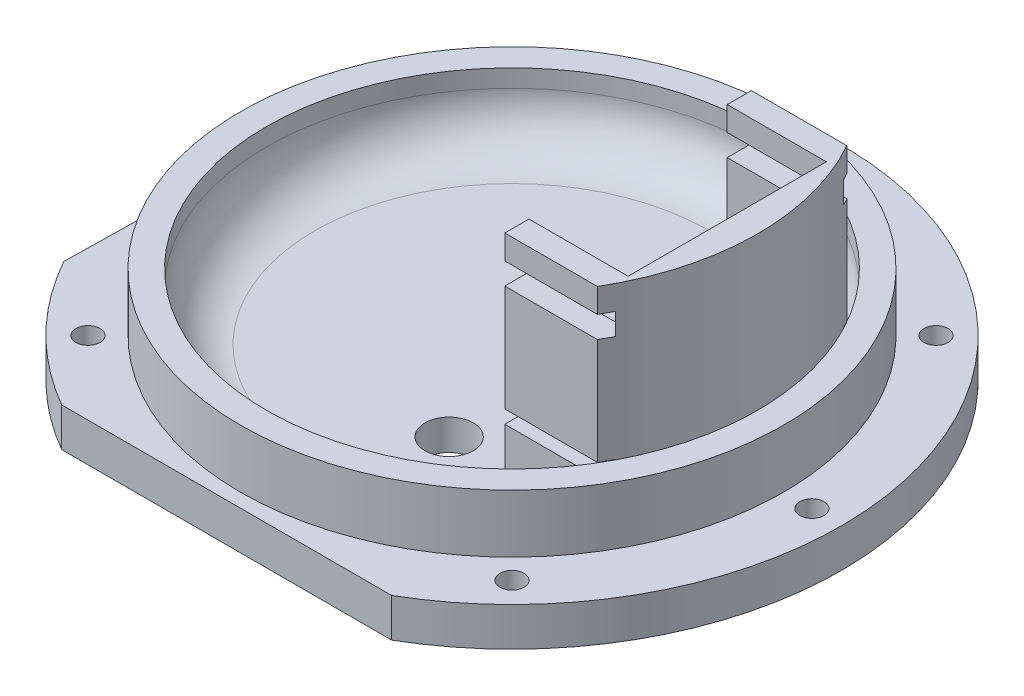
from build123d import *
from build123d.topology import SkipClean

# Parameters (mm, degrees)
SKETCH2_R            = 57.150000000000006
SKETCH2_R_2          = 50.8
BOSS_EXTRUDE1_DEPTH  = 203.2
CUT_EXTRUDE1_DEPTH   = 58.19999999999986
BOSS_EXTRUDE2_START  = -8
BOSS_EXTRUDE2_DEPTH  = 8
SKETCH5_R            = 57.15000000000001
BOSS_EXTRUDE3_DEPTH  = 6.35
FILLET1_R            = 10
FILLET3_R            = 10
BOSS_EXTRUDE4_REACH  = 173.799
BOSS_EXTRUDE5_START  = -43.000000000000014
BOSS_EXTRUDE5_DEPTH  = 43.000000000000014
SKETCH11_R           = 72.83416847853712
CUT_EXTRUDE4_DEPTH   = 150.35000000000005
CUT_EXTRUDE6_START   = -32.85
SKETCH13_R           = 69.77962088639387
SKETCH13_R_2         = 50.8
CUT_EXTRUDE6_DEPTH   = 32.85
SKETCH14_R           = 75.15
SKETCH14_R_2         = 57.15000000000001
BOSS_EXTRUDE7_DEPTH  = 8
CUT_EXTRUDE8_REACH   = 137.056
SKETCH15_W           = 5
SKETCH15_H           = 4.499999999999986
SKETCH15_H_2         = 2.75
SKETCH15_W_2         = 5.0000000000000036
CUT_EXTRUDE11_DEPTH  = 20
SKETCH17_R           = 5.000000000000003
CUT_EXTRUDE12_DEPTH  = 12
SKETCH18_R           = 0.8749999999999984
SKETCH18_R_2         = 0.8750000000042212
SKETCH18_R_3         = 0.8750000000076085
SKETCH18_R_4         = 0.8750000000088883
SKETCH18_R_5         = 0.8750000000075635
SKETCH18_R_6         = 0.8750000000041438
SKETCH18_R_7         = 0.8749999999999648
SKETCH18_R_8         = 0.8749999999966257
SKETCH18_R_9         = 0.8749999999954141
SKETCH18_R_10        = 0.8749999999968092
CUT_EXTRUDE13_DEPTH  = 32
SKETCH19_R           = 61.661434247981944
SKETCH19_R_2         = 56.650000000000006
CUT_EXTRUDE15_DEPTH  = 57
SKETCH20_R           = 62.908450380404645
SKETCH20_R_2         = 56.15000000000001
CUT_EXTRUDE18_DEPTH  = 12
SKETCH21_R           = 85.1423336954409
SKETCH21_R_2         = 68.15000000000002
CUT_EXTRUDE19_DEPTH  = 22.341781740656394
CUT_EXTRUDE20_DEPTH  = 22.341781740656394
CUT_EXTRUDE21_DEPTH  = 22.341781740656394
SKETCH24_R           = 68.15000000000002
SKETCH24_R_2         = 56.15000000000001
BOSS_EXTRUDE8_DEPTH  = 8
SKETCH25_W           = 4.834081711310596
SKETCH25_H           = 26.957976023142425
SKETCH25_W_2         = 7.090932287537861
BOSS_EXTRUDE9_DEPTH  = 8
SKETCH26_R           = 56.15000000000001
SKETCH26_R_2         = 50.8
BOSS_EXTRUDE10_DEPTH = 12
CUT_EXTRUDE22_DEPTH  = 22.341781740656394
CUT_EXTRUDE23_DEPTH  = 23.000000000000007
SKETCH29_R           = 2.5000000000000027
SKETCH29_R_2         = 2.5000000000006923
SKETCH29_R_3         = 2.500000000005469
SKETCH29_R_4         = 2.5000000000116254
SKETCH29_R_5         = 2.500000000015081
SKETCH29_R_6         = 2.500000000004599
CUT_EXTRUDE24_DEPTH  = 20.000000000000004


with BuildPart() as part:
    # Sketch2 → Boss-Extrude1 (new body)
    with BuildSketch(Plane(origin=(0, 0, 0), x_dir=(1, 0, 0), z_dir=(0, 1, 0))):
        with Locations(Location((0, 0, 0), (0, 0, 270))):
            Circle(SKETCH2_R)
        with Locations(Location((0, 0, 0), (0, 0, 270))):
            Circle(SKETCH2_R_2, mode=Mode.SUBTRACT)
    extrude(amount=BOSS_EXTRUDE1_DEPTH)

    # Sketch3 → Cut-Extrude1 (cut)
    with BuildSketch(Plane(origin=(0, 0, -57.150000000000006), x_dir=(-1, 0, 0), z_dir=(0, 0, -1))):
        Polygon((-44.999999999999986, 51.59999999999999), (45.000000000000014, 51.59999999999998), (44.999999999999986, 151.60000000000002), (-45.00000000000003, 151.60000000000002), align=None)
    extrude(amount=-CUT_EXTRUDE1_DEPTH, mode=Mode.SUBTRACT)

    # Sketch4 → Boss-Extrude2 (add)
    with SkipClean():  # the faces are left unmerged after this step: merging them gives an invalid solid
        with BuildSketch(Plane(origin=(0, 203.2, 0), x_dir=(1, 0, 0), z_dir=(0, 1, 0)).offset(BOSS_EXTRUDE2_START)):
            with BuildLine():
                Line((57.00984564090663, -4), (38.593263660903304, -4.0000000000000036))
                ThreePointArc((38.593263660903304, -4.0000000000000036), (-1.3547e-13, -38.800000000000004), (-38.59326366090334, -3.999999999999733))
                Line((-38.59326366090334, -3.999999999999733), (-57.00984564090666, -3.999999999999602))
                ThreePointArc((-57.00984564090666, -3.999999999999602), (-1.9954e-13, -57.15000000000001), (57.00984564090663, -4))
            make_face()
            with BuildLine():
                Line((57.00984564090663, 4), (38.593263660903304, 4.0000000000000036))
                ThreePointArc((38.593263660903304, 4.0000000000000036), (1.3161e-13, 38.8), (-38.59326366090328, 4.000000000000275))
                Line((-38.59326366090328, 4.000000000000275), (-57.009845640906605, 4.0000000000004))
                ThreePointArc((-57.009845640906605, 4.0000000000004), (1.9385e-13, 57.150000000000006), (57.00984564090663, 4))
            make_face()
        extrude(amount=BOSS_EXTRUDE2_DEPTH)

    # Sketch5 → Boss-Extrude3 (add)
    with BuildSketch(Plane.XZ):
        with Locations(Location((0, 0, 0), (0, 0, 90))):
            Circle(SKETCH5_R)
    extrude(amount=-BOSS_EXTRUDE3_DEPTH)

    # Fillet1
    fillet1_edges = [part.edges().sort_by_distance(p)[0] for p in [
        (3.11e-15, 6.35, -50.8),
    ]]
    fillet(fillet1_edges, radius=FILLET1_R)

    # Fillet3
    # the kernel refuses this fillet: 10 mm, written as the material it takes off along each edge
    with BuildSketch(Plane(origin=(0, 203.2, 0), x_dir=(-0.9975476052652084, 0, 0.06999125109360571), z_dir=(-0.06999125109360571, 0, -0.9975476052652084))) as fillet3_piece_1:
        with BuildLine():
            CenterArc((57.15 - FILLET3_R, -FILLET3_R), FILLET3_R, 0, 90)
            Line((57.15, -FILLET3_R), (57.15, 0))
            Line((57.15, 0), (57.15 - FILLET3_R, 0))
        make_face()
    revolve(axis=Axis((0, 203.2, 0), (0, 1, 0)), revolution_arc=85.98651528985741, mode=Mode.SUBTRACT)
    with BuildSketch(Plane(origin=(0, 203.2, 0), x_dir=(-0.9975476052652074, 0, -0.06999125109362063), z_dir=(0.06999125109362063, 0, -0.9975476052652074))) as fillet3_piece_2:
        with BuildLine():
            CenterArc((57.150000000000006 - FILLET3_R, -FILLET3_R), FILLET3_R, 0, 90)
            Line((57.150000000000006, -FILLET3_R), (57.150000000000006, 0))
            Line((57.150000000000006, 0), (57.150000000000006 - FILLET3_R, 0))
        make_face()
    revolve(axis=Axis((0, 203.2, 0), (0, 1, 0)), revolution_arc=8.026969420285985, mode=Mode.SUBTRACT)
    with BuildSketch(Plane(origin=(0, 203.2, 0), x_dir=(-1.8e-16, 0, 1), z_dir=(-1, 0, -1.8e-16))) as fillet3_piece_3:
        with BuildLine():
            CenterArc((57.150000000000006 - FILLET3_R, -FILLET3_R), FILLET3_R, 0, 90)
            Line((57.150000000000006, -FILLET3_R), (57.150000000000006, 0))
            Line((57.150000000000006, 0), (57.150000000000006 - FILLET3_R, 0))
        make_face()
    revolve(axis=Axis((0, 203.2, 0), (0, 1, 0)), revolution_arc=85.98651528985701, mode=Mode.SUBTRACT)
    with BuildSketch(Plane(origin=(0, 203.2, 0), x_dir=(0.9975476052652078, 0, 0.06999125109361341), z_dir=(-0.06999125109361341, 0, 0.9975476052652078))) as fillet3_piece_4:
        with BuildLine():
            CenterArc((57.15000000000001 - FILLET3_R, -FILLET3_R), FILLET3_R, 0, 90)
            Line((57.15000000000001, -FILLET3_R), (57.15000000000001, 0))
            Line((57.15000000000001, 0), (57.15000000000001 - FILLET3_R, 0))
        make_face()
    revolve(axis=Axis((0, 203.2, 0), (0, 1, 0)), revolution_arc=8.026969420286012, mode=Mode.SUBTRACT)
    with BuildSketch(Plane(origin=(0, 203.2, -3.55e-15), x_dir=(-0.9975476052652074, 0, -0.06999125109362023), z_dir=(-0.06999125109362023, 0, 0.9975476052652074))) as fillet3_piece_5:
        with BuildLine():
            CenterArc((57.15000000000001 - FILLET3_R, FILLET3_R), FILLET3_R, 270, 90)
            Line((57.15000000000001, FILLET3_R), (57.15000000000001, 0))
            Line((57.15000000000001, 0), (57.15000000000001 - FILLET3_R, 0))
        make_face()
    revolve(axis=Axis((0, 203.2, -3.55e-15), (0, -1, 0)), revolution_arc=171.9730305797136, mode=Mode.SUBTRACT)

    # Boss-Extrude4: up to this face of the body (flat: up to its plane)
    boss_extrude4_end = Plane(part.part.faces().sort_by_distance((0, 6.35, 0))[0])
    # Sketch8 → Boss-Extrude4 (add, up to the picked face)
    with BuildSketch(Plane(origin=(-3.98e-15, 51.59999999999999, 0), x_dir=(1, 8e-17, 0), z_dir=(-8e-17, 1, 0)), mode=Mode.PRIVATE) as boss_extrude4_sk1:
        Polygon((44.999999999999986, -21), (44.99999999999999, 20), (24.49999999999999, 19.999999999999996), (24.49999999999999, 24.999999999999996), (49.999999999999986, 25), (49.999999999999986, -26.000000000000004), (24.499999999999982, -25.999999999999996), (24.499999999999982, -20.99999999999999), align=None)
    boss_extrude4_tool1 = split(extrude(boss_extrude4_sk1.sketch, amount=-BOSS_EXTRUDE4_REACH, mode=Mode.PRIVATE), bisect_by=boss_extrude4_end, keep=Keep.BOTH, mode=Mode.PRIVATE)
    add(boss_extrude4_tool1.solids().sort_by(Axis((45.570197, 51.6, 0.5), (8e-17, -1, 0)))[0])

    # Sketch9 → Boss-Extrude5 (add)
    with SkipClean():  # the faces are left unmerged after this step: merging them gives an invalid solid
        with BuildSketch(Plane(origin=(-3.98e-15, 51.59999999999999, 0), x_dir=(1, 8e-17, 0), z_dir=(-8e-17, 1, 0)).offset(BOSS_EXTRUDE5_START)):
            with BuildLine():
                Line((49.999999999999986, -8.97997772825755), (49.999999999999964, 8.979977728257717))
                ThreePointArc((49.999999999999964, 8.979977728257717), (50.800000000000004, 8.319e-14), (49.999999999999986, -8.97997772825755))
            make_face()
        extrude(amount=BOSS_EXTRUDE5_DEPTH)

    # Sketch11 → Cut-Extrude4 (cut)
    with BuildSketch(Plane(origin=(0, 203.2, 0), x_dir=(1, 0, 0), z_dir=(0, 1, 0))):
        Circle(SKETCH11_R)
    extrude(amount=-CUT_EXTRUDE4_DEPTH, mode=Mode.SUBTRACT)

    # Sketch13 → Cut-Extrude6 (cut)
    with BuildSketch(Plane(origin=(0, 52.84999999999995, 0), x_dir=(1, 0, 0), z_dir=(0, 1, 0)).offset(CUT_EXTRUDE6_START)):
        Circle(SKETCH13_R)
        Circle(SKETCH13_R_2, mode=Mode.SUBTRACT)
    extrude(amount=CUT_EXTRUDE6_DEPTH, mode=Mode.SUBTRACT)

    # Sketch14 → Boss-Extrude7 (add)
    with BuildSketch(Plane.XZ):
        with Locations(Location((0, 0, 0), (0, 0, 270))):
            Circle(SKETCH14_R)
        with Locations(Location((0, 0, 0), (0, 0, 270))):
            Circle(SKETCH14_R_2, mode=Mode.SUBTRACT)
    extrude(amount=-BOSS_EXTRUDE7_DEPTH)

    # Cut-Extrude8: up to this face of the body (flat: up to its plane)
    cut_extrude8_end = Plane(part.part.faces().sort_by_distance((45, 29.950685238, 0.465203094))[0])
    # Sketch15 → Cut-Extrude8 (cut, up to the picked face)
    with BuildSketch(Plane.ZY.offset(-24.49999999999999), mode=Mode.PRIVATE) as cut_extrude8_sk1:
        with Locations((-22.499999999999996, 44.34999999999999)):
            Rectangle(SKETCH15_W, SKETCH15_H)
    cut_extrude8_tool1 = split(extrude(cut_extrude8_sk1.sketch, amount=-CUT_EXTRUDE8_REACH, mode=Mode.PRIVATE), bisect_by=cut_extrude8_end, keep=Keep.BOTH, mode=Mode.PRIVATE)
    # Sketch15 → Cut-Extrude8 (cut, up to the picked face)
    with BuildSketch(Plane.ZY.offset(-24.49999999999999), mode=Mode.PRIVATE) as cut_extrude8_sk2:
        with Locations((-22.499999999999996, 18.724999999999994)):
            Rectangle(SKETCH15_W, SKETCH15_H_2)
    cut_extrude8_tool2 = split(extrude(cut_extrude8_sk2.sketch, amount=-CUT_EXTRUDE8_REACH, mode=Mode.PRIVATE), bisect_by=cut_extrude8_end, keep=Keep.BOTH, mode=Mode.PRIVATE)
    # Sketch15 → Cut-Extrude8 (cut, up to the picked face)
    with BuildSketch(Plane.ZY.offset(-24.49999999999999), mode=Mode.PRIVATE) as cut_extrude8_sk3:
        with Locations((23.499999999999993, 18.724999999999994)):
            Rectangle(SKETCH15_W_2, SKETCH15_H_2)
    cut_extrude8_tool3 = split(extrude(cut_extrude8_sk3.sketch, amount=-CUT_EXTRUDE8_REACH, mode=Mode.PRIVATE), bisect_by=cut_extrude8_end, keep=Keep.BOTH, mode=Mode.PRIVATE)
    # Sketch15 → Cut-Extrude8 (cut, up to the picked face)
    with BuildSketch(Plane.ZY.offset(-24.49999999999999), mode=Mode.PRIVATE) as cut_extrude8_sk4:
        with Locations((23.499999999999993, 44.34999999999999)):
            Rectangle(SKETCH15_W_2, SKETCH15_H)
    cut_extrude8_tool4 = split(extrude(cut_extrude8_sk4.sketch, amount=-CUT_EXTRUDE8_REACH, mode=Mode.PRIVATE), bisect_by=cut_extrude8_end, keep=Keep.BOTH, mode=Mode.PRIVATE)
    add(cut_extrude8_tool1.solids().sort_by(Axis((24.5, 44.35, -22.5), (1, 8e-17, 0)))[0], mode=Mode.SUBTRACT)
    add(cut_extrude8_tool2.solids().sort_by(Axis((24.5, 18.725, -22.5), (1, 8e-17, 0)))[0], mode=Mode.SUBTRACT)
    add(cut_extrude8_tool3.solids().sort_by(Axis((24.5, 18.725, 23.5), (1, 8e-17, 0)))[0], mode=Mode.SUBTRACT)
    add(cut_extrude8_tool4.solids().sort_by(Axis((24.5, 44.35, 23.5), (1, 8e-17, 0)))[0], mode=Mode.SUBTRACT)

    # Sketch16 → Cut-Extrude11 (cut)
    with BuildSketch(Plane.XZ):
        with BuildLine():
            Line((-54.737873109759654, 16.428260632819722), (-54.73787310975964, 51.49065689443021))
            ThreePointArc((-54.73787310975907, 51.49065689443004), (-75.15, -1.2429e-13), (-54.737873109758894, -51.49065689443022))
            Line((-54.737873109759654, -51.49065689443049), (-54.737873109759654, -14.79279741723212))
            ThreePointArc((-54.737873109759654, -14.79279741723212), (-56.63694723674982, -8.92977771745283), (-61.61287310975965, -5.293619821250452))
            ThreePointArc((-61.61287310975965, -5.293619821250452), (-65.73787310975965, 0.4058867363385459), (-61.61287310975965, 6.105393293927545))
            ThreePointArc((-61.61287310975965, 6.105393293927547), (-56.63694723674983, 9.741551190129925), (-54.737873109759654, 15.604570889909208))
            Line((-54.737873109759654, 15.604570889909212), (-54.737873109759654, 16.428260632819722))
        make_face()
        with BuildLine():
            Line((54.73787310975964, 51.49065689443209), (54.73787310975964, 16.428260632819722))
            Line((54.737873109759654, 16.428260632819722), (54.737873109759654, 15.604570889909212))
            ThreePointArc((54.737873109759654, 15.604570889909208), (56.63694723674983, 9.741551190129925), (61.61287310975965, 6.105393293927543))
            ThreePointArc((61.61287310975965, 6.105393293927545), (65.73787310975965, 0.40588673633854544), (61.61287310975965, -5.293619821250453))
            ThreePointArc((61.61287310975965, -5.293619821250456), (56.63694723674982, -8.92977771745283), (54.737873109759654, -14.792797417232117))
            Line((54.737873109759654, -14.79279741723212), (54.737873109759654, -51.49065689443195))
            ThreePointArc((54.73787310975783, -51.49065689443136), (69.86083904519863, -27.694506095990416), (75.15, -1.841e-14))
            ThreePointArc((75.15, 0), (69.86083904519862, 27.69450609599047), (54.737873109757736, 51.49065689443146))
        make_face()
    extrude(amount=-CUT_EXTRUDE11_DEPTH, mode=Mode.SUBTRACT)

    # Sketch17 → Cut-Extrude12 (cut)
    with BuildSketch(Plane(origin=(0, 6.35, 0), x_dir=(1, 0, 0), z_dir=(0, 1, 0))):
        with Locations(Location((10, -23, 0), (0, 0, 270))):
            Circle(SKETCH17_R)
    extrude(amount=-CUT_EXTRUDE12_DEPTH, mode=Mode.SUBTRACT)

    # Sketch18 → Cut-Extrude13 (cut)
    with BuildSketch(Plane.XZ):
        with Locations(Location((-59.73787310975964, 0.40588673633854594, 0), (0, 0, 270))):
            Circle(SKETCH18_R)
        with Locations(Location((-48.090380315892816, 35.44141008472639, 0), (0, 0, 270))):
            Circle(SKETCH18_R_2)
        with Locations(Location((-18.07399677326383, 56.93951938997465, 0), (0, 0, 270))):
            Circle(SKETCH18_R_3)
        with Locations(Location((18.846039224196023, 56.68866759133887, 0), (0, 0, 270))):
            Circle(SKETCH18_R_4)
        with Locations(Location((48.56752879132669, 34.784671549758876, 0), (0, 0, 270))):
            Circle(SKETCH18_R_5)
        with Locations(Location((59.73787310975968, -0.40588673632493744, 0), (0, 0, 270))):
            Circle(SKETCH18_R_6)
        with Locations(Location((48.090380315892865, -35.4414100847128, 0), (0, 0, 270))):
            Circle(SKETCH18_R_7)
        with Locations(Location((18.073996773263875, -56.93951938996104, 0), (0, 0, 270))):
            Circle(SKETCH18_R_8)
        with Locations(Location((-18.846039224195973, -56.68866759132527, 0), (0, 0, 270))):
            Circle(SKETCH18_R_9)
        with Locations(Location((-48.56752879132665, -34.78467154974528, 0), (0, 0, 270))):
            Circle(SKETCH18_R_10)
    extrude(amount=-CUT_EXTRUDE13_DEPTH, mode=Mode.SUBTRACT)

    # Sketch19 → Cut-Extrude15 (cut)
    with BuildSketch(Plane(origin=(0, 8, 0), x_dir=(1, 0, 0), z_dir=(0, 1, 0))):
        Circle(SKETCH19_R)
        Circle(SKETCH19_R_2, mode=Mode.SUBTRACT)
    extrude(amount=CUT_EXTRUDE15_DEPTH, mode=Mode.SUBTRACT)

    # Sketch20 → Cut-Extrude18 (cut)
    with BuildSketch(Plane(origin=(0, 20, 0), x_dir=(1, 0, 0), z_dir=(0, 1, 0))):
        Circle(SKETCH20_R)
        with Locations(Location((0, 0, 0), (0, 0, 270))):
            Circle(SKETCH20_R_2, mode=Mode.SUBTRACT)
    extrude(amount=-CUT_EXTRUDE18_DEPTH, mode=Mode.SUBTRACT)

    # Sketch21 → Cut-Extrude19 (cut)
    with BuildSketch(Plane.XZ):
        Circle(SKETCH21_R)
        Circle(SKETCH21_R_2, mode=Mode.SUBTRACT)
    extrude(amount=-CUT_EXTRUDE19_DEPTH, mode=Mode.SUBTRACT)

    # Sketch22 → Cut-Extrude20 (cut)
    with BuildSketch(Plane.XZ):
        Polygon((-54.737873109759654, -40.59787860738356), (-54.73787310975965, 40.597878607383564), (-78.99171066162528, 16.344041055517692), (-75.2405601417685, -31.23433815608223), align=None)
    extrude(amount=-CUT_EXTRUDE20_DEPTH, mode=Mode.SUBTRACT)

    # Sketch23 → Cut-Extrude21 (cut)
    with BuildSketch(Plane.XZ):
        Polygon((54.737873109759654, -40.59787860738356), (54.73787310975965, 40.597878607383564), (94.31920634637336, 49.22615893846238), (88.54205197093279, -58.98150331346308), align=None)
    extrude(amount=-CUT_EXTRUDE21_DEPTH, mode=Mode.SUBTRACT)

    # Sketch24 → Boss-Extrude8 (add)
    with SkipClean():  # the faces are left unmerged after this step: merging them gives an invalid solid
        with BuildSketch(Plane(origin=(0, 8, 0), x_dir=(1, 0, 0), z_dir=(0, 1, 0))):
            with Locations(Location((0, 0, 0), (0, 0, 90))):
                Circle(SKETCH24_R)
            Circle(SKETCH24_R_2, mode=Mode.SUBTRACT)
        extrude(amount=-BOSS_EXTRUDE8_DEPTH)

    # Sketch25 → Boss-Extrude9 (add)
    with SkipClean():  # the faces are left unmerged after this step: merging them gives an invalid solid
        with BuildSketch(Plane.XZ):
            with Locations((-57.15491396541495, -0.965485407589675)):
                Rectangle(SKETCH25_W, SKETCH25_H)
            with Locations((58.28333925352858, -0.965485407589675)):
                Rectangle(SKETCH25_W_2, SKETCH25_H)
        extrude(amount=-BOSS_EXTRUDE9_DEPTH)

    # Sketch26 → Boss-Extrude10 (add)
    with SkipClean():  # the faces are left unmerged after this step: merging them gives an invalid solid
        with BuildSketch(Plane(origin=(0, 20, 0), x_dir=(1, 0, 0), z_dir=(0, 1, 0))):
            with Locations(Location((0, 0, 0), (0, 0, 270))):
                Circle(SKETCH26_R)
            Circle(SKETCH26_R_2, mode=Mode.SUBTRACT)
        extrude(amount=-BOSS_EXTRUDE10_DEPTH)

    # Sketch27 → Cut-Extrude22 (cut)
    with SkipClean():  # the faces are left unmerged after this step: merging them gives an invalid solid
        with BuildSketch(Plane.XZ):
            Polygon((-97.49945398726112, 59), (123.90067473493716, 59), (86.16317158570385, 139.51895776078516), (3.3533322879772953, 131.06593853621007), align=None)
        extrude(amount=-CUT_EXTRUDE22_DEPTH, mode=Mode.SUBTRACT)

    # Sketch28 → Cut-Extrude23 (cut)
    with SkipClean():  # the faces are left unmerged after this step: merging them gives an invalid solid
        with BuildSketch(Plane(origin=(0, 8, 0), x_dir=(1, 0, 0), z_dir=(0, 1, 0))):
            Polygon((-59.58389484660223, -33.07842159035176), (-58.398282481976096, 35.12923430926618), (-73.14915352812937, 35.385639765085735), (-74.58802381991613, -47.39181151201986), align=None)
        extrude(amount=-CUT_EXTRUDE23_DEPTH, mode=Mode.SUBTRACT)

    # Sketch29 → Cut-Extrude24 (cut)
    with SkipClean():  # the faces are left unmerged after this step: merging them gives an invalid solid
        with BuildSketch(Plane(origin=(0, 8, 0), x_dir=(1, 0, 0), z_dir=(0, 1, 0))):
            with Locations(Location((0, 62, 0), (0, 0, 270))):
                Circle(SKETCH29_R)
            with Locations(Location((43.84062043356826, 43.84062043357155, 0), (0, 0, 270))):
                Circle(SKETCH29_R_2)
            with Locations(Location((62.000000000007915, 7.92206e-12, 0), (0, 0, 270))):
                Circle(SKETCH29_R_3)
            with Locations(Location((43.84062043357947, -43.840620433560346, 0), (0, 0, 270))):
                Circle(SKETCH29_R_4)
            with Locations(Location((-43.840620433552424, -43.84062043357156, 0), (0, 0, 270))):
                Circle(SKETCH29_R_5)
            with Locations(Location((-43.84062043356364, 43.84062043356034, 0), (0, 0, 270))):
                Circle(SKETCH29_R_6)
        extrude(amount=-CUT_EXTRUDE24_DEPTH, mode=Mode.SUBTRACT)


solid = part.part
